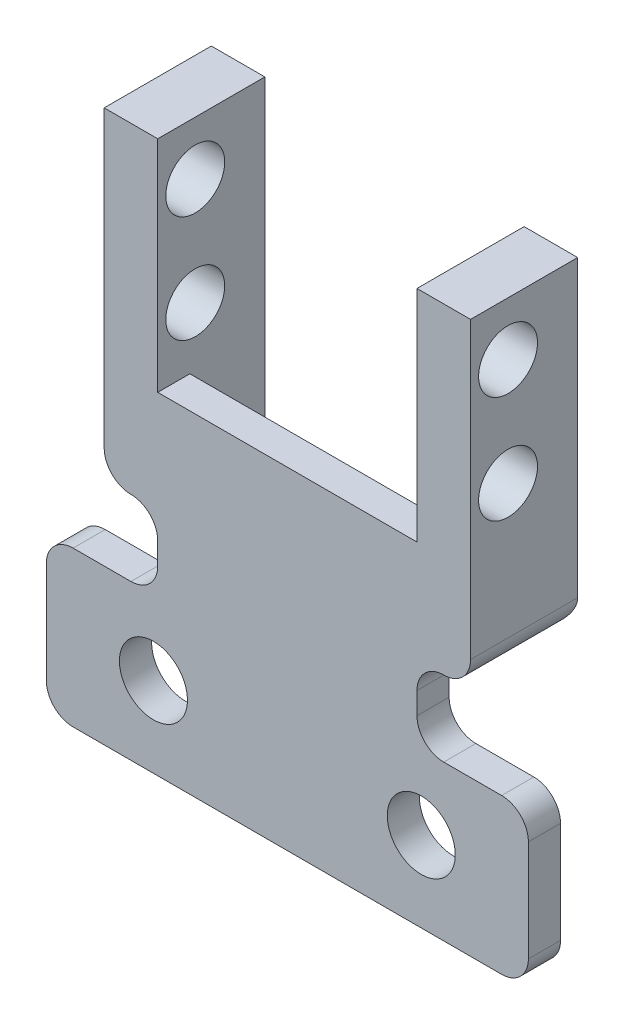
from build123d import *

# Parameters (mm, degrees)
SKETCH1_W                   = 45
SKETCH1_H                   = 14.46
BOSS_EXTRUDE1_DEPTH         = 3
F_1_4_0_25_DIAMETER_HOLE1_D = 6.35
SKETCH5_W                   = 24.2
SKETCH5_H                   = 37.04
BOSS_EXTRUDE2_DEPTH         = 3
SKETCH6_W                   = 10
SKETCH6_H                   = 30
BOSS_EXTRUDE3_DEPTH         = 5
BOSS_EXTRUDE4_START         = -29.2
SKETCH7_W                   = 10
SKETCH7_H                   = 30
BOSS_EXTRUDE4_DEPTH         = 5
SKETCH12_W                  = 24.2
SKETCH12_H                  = 20.5
CUT_EXTRUDE1_DEPTH          = 3
M5_CLEARANCE_HOLE1_D        = 5.5
FILLET3_R                   = 2.5
FILLET4_R                   = 2.5


with BuildPart() as part:
    # Sketch1 → Boss-Extrude1 (new body)
    with BuildSketch(Plane.XY):
        with Locations((13.988651535, -1.802042724)):
            Rectangle(SKETCH1_W, SKETCH1_H)
    extrude(amount=BOSS_EXTRUDE1_DEPTH)

    # 1/4 (0.25) Diameter Hole1 (through all)
    with Locations(Plane(origin=(0, 0, 0), x_dir=(-1, 0, 0), z_dir=(0, 0, -1))):
        with Locations((-26.488651535, -1.532042724), (-1.488651535, -1.532042724)):
            Hole(F_1_4_0_25_DIAMETER_HOLE1_D / 2)

    # Sketch5 → Boss-Extrude2 (add)
    with BuildSketch(Plane(origin=(0, 0, 0), x_dir=(-1, 0, 0), z_dir=(0, 0, -1))):
        with Locations((-13.988651535, 23.947957276)):
            Rectangle(SKETCH5_W, SKETCH5_H)
    extrude(amount=-BOSS_EXTRUDE2_DEPTH)

    # Sketch6 → Boss-Extrude3 (add)
    with BuildSketch(Plane.ZY.offset(-1.888651535)):
        with Locations((-2, 27.467957276)):
            Rectangle(SKETCH6_W, SKETCH6_H)
    extrude(amount=BOSS_EXTRUDE3_DEPTH)

    # Sketch7 → Boss-Extrude4 (add)
    with BuildSketch(Plane.ZY.offset(3.111348465).offset(BOSS_EXTRUDE4_START)):
        with Locations((-2, 27.467957276)):
            Rectangle(SKETCH7_W, SKETCH7_H)
    extrude(amount=-BOSS_EXTRUDE4_DEPTH)

    # Sketch12 → Cut-Extrude1 (cut)
    with BuildSketch(Plane(origin=(0, 0, 0), x_dir=(-1, 0, 0), z_dir=(0, 0, -1))):
        with Locations((-13.988651535, 32.217957276)):
            Rectangle(SKETCH12_W, SKETCH12_H)
    extrude(amount=-CUT_EXTRUDE1_DEPTH, mode=Mode.SUBTRACT)

    # M5 Clearance Hole1 (through all)
    with Locations(Plane.ZY.offset(3.111348465)):
        with Locations((-0.5, 37.467957276), (-0.5, 27.467957276)):
            Hole(M5_CLEARANCE_HOLE1_D / 2)

    # Fillet3
    fillet3_edges = [part.edges().sort_by_distance(p)[0] for p in [
        (-8.511348465, 5.427957276, 1.5),
        (36.488651535, 5.427957276, 1.5),
        (36.488651535, -9.032042724, 1.5),
        (-8.511348465, -9.032042724, 1.5),
    ]]
    fillet(fillet3_edges, radius=FILLET3_R)

    # Fillet4
    fillet4_edges = [part.edges().sort_by_distance(p)[0] for p in [
        (1.888651535, 5.427957276, 1.5),
        (26.088651535, 5.427957276, 1.5),
        (26.088651535, 12.467957276, 1.5),
        (1.888651535, 12.467957276, 1.5),
        (31.088651535, 12.467957276, -2),
        (-3.111348465, 12.467957276, -2),
        (28.588651535, 12.467957276, -7),
        (-0.611348465, 12.467957276, -7),
    ]]
    fillet(fillet4_edges, radius=FILLET4_R - 0.0001)  # a hair under: the kernel refuses the full size


solid = part.part
